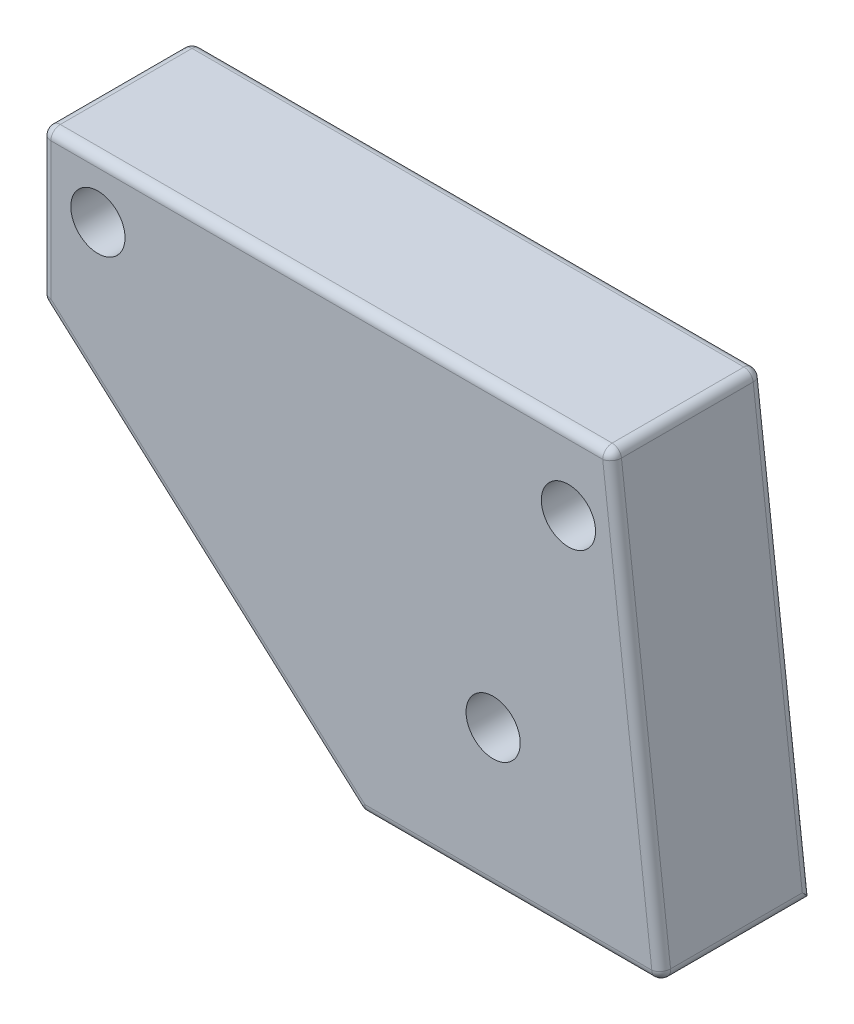
from build123d import *

# Parameters (mm, degrees)
SKETCH1_R           = 2.286
BOSS_EXTRUDE1_DEPTH = 12.7
SKETCH3_R           = 1.905
CUT_EXTRUDE1_DEPTH  = 25.4
FILLET1_R           = 0.79375


with BuildPart() as part:
    # Sketch1 → Boss-Extrude1 (new body)
    with BuildSketch(Plane.XY):
        Polygon((-25.4, 0), (0, 0), (-4.326530641, 36.83), (-52.3748, 36.83), (-52.3748, 24.13), align=None)
        with Locations((-47.6123, 32.0675)):
            Circle(SKETCH1_R, mode=Mode.SUBTRACT)
        with Locations((-7.9248, 30.48)):
            Circle(SKETCH1_R, mode=Mode.SUBTRACT)
        with Locations((-14.2748, 11.826875)):
            Circle(SKETCH1_R, mode=Mode.SUBTRACT)
    extrude(amount=BOSS_EXTRUDE1_DEPTH)

    # Sketch3 → Cut-Extrude1 (cut)
    with BuildSketch(Plane.XZ):
        with Locations((-19.05, 6.35)):
            Circle(SKETCH3_R)
        with Locations((-6.35, 6.35)):
            Circle(SKETCH3_R)
    extrude(amount=-CUT_EXTRUDE1_DEPTH, mode=Mode.SUBTRACT)

    # Fillet1
    fillet1_edges = [part.edges().sort_by_distance(p)[0] for p in [
        (-52.3748, 30.48, 12.7),
        (-52.3748, 30.48, 0),
        (-52.3748, 24.13, 6.35),
        (-38.8874, 12.065, 12.7),
        (-25.4, 0, 6.35),
        (-38.8874, 12.065, 0),
        (0, 0, 6.35),
        (-2.163265321, 18.415, 12.7),
        (-2.163265321, 18.415, 0),
        (-4.326530641, 36.83, 6.35),
        (-28.350665321, 36.83, 12.7),
        (-52.3748, 36.83, 6.35),
        (-28.350665321, 36.83, 0),
        (-12.7, 0, 12.7),
    ]]
    fillet(fillet1_edges, radius=FILLET1_R)


solid = part.part
